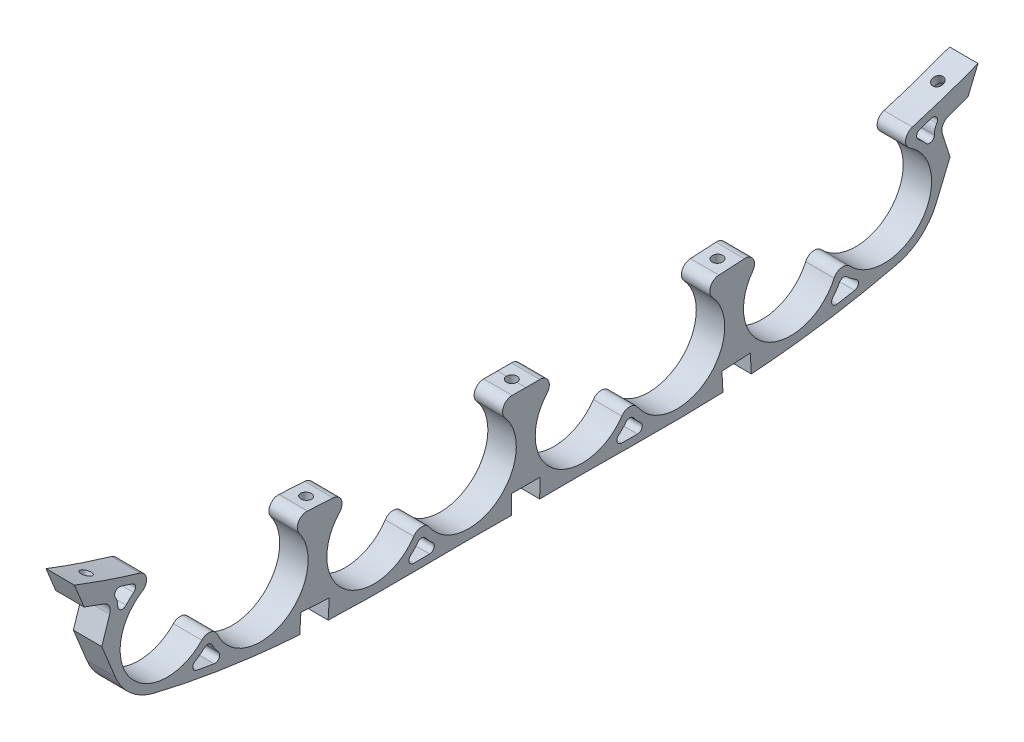
from build123d import *

# Parameters (mm, degrees)
BOSS_EXTRUDE2_DEPTH = 4.7625
CUT_EXTRUDE1_DEPTH  = 156.327035229
SKETCH3_R           = 1.778
CUT_EXTRUDE2_DEPTH  = 155.926710555
SKETCH4_R           = 1.778
CUT_EXTRUDE3_DEPTH  = 154.47151085
SKETCH5_R           = 3.175
CUT_EXTRUDE4_DEPTH  = 3.556
SKETCH6_R           = 1.778
CUT_EXTRUDE5_DEPTH  = 141.566856419


# Read off the part's stored shape, not the designer's step: Mirror1
with BuildPart() as part:
    # Sketch1 → Boss-Extrude2 (new, symmetric)
    with BuildSketch(Plane(origin=(-4.793989049, 0.020738597, -8e-09), x_dir=(-1.5740645192279891e-09, 3.5988585896806374e-12, 1.0), z_dir=(-0.9999906431736159, 0.00432591784689156, -1.5740653593461668e-09))):
        with BuildLine():
            Line((4.097149249, -41.793027475), (4.097149249, -13.281595194))
            add(Edge.make_bspline(
                [(-0.53953751, -13.252646952), (1.006219979, -13.26531204), (2.551775373, -13.275970228), (4.097149249, -13.281595194)],
                knots=[0.971364633, 0.971364633, 0.971364633, 0.971364633, 1, 1, 1, 1], degree=3))
            ThreePointArc((-0.53953751, -13.252646952), (-3.448723494, -15.097901159), (-2.963434091, -18.508593226))
            ThreePointArc((-2.963434091, -18.508593226), (-2.597042641, -18.94642841), (-2.246631473, -19.397154887))
            ThreePointArc((-2.246631473, -19.397154887), (0.109135751, -23.898660497), (0.922149671, -28.913857436))
            ThreePointArc((0.922149671, -28.913857436), (-10.330023088, -44.100861528), (-28.135499878, -37.75882074))
            ThreePointArc((-28.135499878, -37.75882074), (-30.788793596, -36.352857657), (-33.427092785, -37.786760419))
            ThreePointArc((-33.427092785, -37.786760419), (-56.000004833, -41.948908373), (-59.135509194, -19.210648845))
            add(Edge.make_bspline(
                [(-71.253324978, -18.51695643), (-67.22219572, -18.825212212), (-63.182502669, -19.053825628), (-59.135509194, -19.210648845)],
                knots=[0.535293106, 0.535293106, 0.535293106, 0.535293106, 0.609991772, 0.609991772, 0.609991772, 0.609991772], degree=3))
            ThreePointArc((-71.253324978, -18.51695643), (-69.473338821, -22.537426481), (-68.864440234, -26.891938239))
            ThreePointArc((-68.864440234, -26.891938239), (-81.471963152, -42.427034587), (-99.26938115, -33.286970841))
            ThreePointArc((-99.26938115, -33.286970841), (-101.634862692, -31.437323087), (-104.483804941, -32.386126439))
            ThreePointArc((-104.483804941, -32.386126439), (-127.878968465, -32.047286598), (-125.5261293, -8.76826951))
            add(Edge.make_bspline(
                [(-144.126574407, -2.696164985), (-141.693386447, -3.582520341), (-137.657540812, -4.990682155), (-131.449532285, -7.006389931), (-127.680307088, -8.145409373), (-125.5261293, -8.76826951)],
                knots=[0.075396222, 0.075396222, 0.075396222, 0.075396222, 0.123289108, 0.154539108, 0.195826457, 0.195826457, 0.195826457, 0.195826457], degree=3))
            Line((-144.126574407, -2.696164985), (-144.035345412, -2.91800212))
            Line((-144.035345412, -2.91800212), (-137.372810366, -5.342490109))
            ThreePointArc((-137.372810366, -5.342490109), (-135.605099648, -6.933772668), (-135.438662345, -9.306383042))
            Line((-135.438662345, -9.306383042), (-138.072044537, -17.41867238))
            Line((-138.072044537, -17.41867238), (-133.451933082, -28.653173909))
            ThreePointArc((-133.451933082, -28.653173909), (-128.289952657, -35.791230262), (-120.447393147, -39.802732565))
            add(Edge.make_bspline(
                [(-120.447393147, -39.802732565), (-119.532951115, -40.023476944), (-117.088169027, -40.601323697), (-110.953698267, -41.968369708), (-101.9631708, -43.710437587), (-90.800466979, -45.403836777), (-79.689088478, -46.662973433), (-68.62645086, -47.527275454), (-57.58924724, -48.037878216), (-46.678774083, -48.224931934), (-36.12400945, -48.204712413), (-25.891642086, -48.098211972), (-17.621930281, -48.025348577), (-11.245188421, -48.026081616), (-6.353163032, -48.062670944), (-2.777855823, -48.097005295), (-0.863208778, -48.112845404), (-0.665350758, -48.114448781)],
                knots=[0.270797205, 0.270797205, 0.270797205, 0.270797205, 0.286422205, 0.3125, 0.375, 0.4375, 0.5, 0.5625, 0.625, 0.6875, 0.75, 0.8125, 0.875, 0.90625, 0.9375, 0.96875, 0.972344137, 0.972344137, 0.972344137, 0.972344137], degree=3))
            Line((-0.665350758, -48.114448781), (-0.665350758, -43.034495919))
            Line((-0.665350758, -43.034495919), (-0.665350758, -41.793027475))
            Line((-0.665350758, -41.793027475), (4.097149249, -41.793027475))
        make_face()
        with BuildLine():
            add(Edge.make_bspline(
                [(-71.253324978, -18.51695643), (-67.22219572, -18.825212212), (-63.182502669, -19.053825628), (-59.135509194, -19.210648845)],
                knots=[0.535293106, 0.535293106, 0.535293106, 0.535293106, 0.609991772, 0.609991772, 0.609991772, 0.609991772], degree=3))
            ThreePointArc((-59.135509194, -19.210648845), (-58.759053909, -18.754205992), (-58.365851515, -18.312108112))
            ThreePointArc((-58.365851515, -18.312108112), (-57.76280435, -14.949065781), (-60.559443008, -12.986279033))
            add(Edge.make_bspline(
                [(-69.125672753, -12.496550273), (-66.277756699, -12.698507159), (-63.422545246, -12.86072552), (-60.559443008, -12.986279033)],
                knots=[0.545675689, 0.545675689, 0.545675689, 0.545675689, 0.599534345, 0.599534345, 0.599534345, 0.599534345], degree=3))
            ThreePointArc((-69.125672753, -12.496550273), (-72.12797251, -14.125760688), (-71.915123748, -17.534987259))
            ThreePointArc((-71.915123748, -17.534987259), (-71.575065183, -18.019799009), (-71.253324978, -18.51695643))
        make_face()
        with BuildLine():
            ThreePointArc((-124.56901985, -8.106582367), (-123.133846678, -4.986374862), (-125.377235322, -2.385870238))
            add(Edge.make_bspline(
                [(-147.334055934, 5.103312683), (-146.182922193, 4.656581809), (-145.029544194, 4.21810499), (-140.778446111, 2.634569298), (-137.662571866, 1.536548298), (-131.493778533, -0.519119884), (-128.444300845, -1.478850673), (-125.377235322, -2.385870238)],
                knots=[0.039153992, 0.039153992, 0.039153992, 0.039153992, 0.0625, 0.0625, 0.125, 0.125, 0.185264169, 0.185264169, 0.185264169, 0.185264169], degree=3))
            Line((-147.334055934, 5.103312683), (-144.126574407, -2.696164985))
            add(Edge.make_bspline(
                [(-144.126574407, -2.696164985), (-141.693386447, -3.582520341), (-137.657540812, -4.990682155), (-131.449532285, -7.006389931), (-127.680307088, -8.145409373), (-125.5261293, -8.76826951)],
                knots=[0.075396222, 0.075396222, 0.075396222, 0.075396222, 0.123289108, 0.154539108, 0.195826457, 0.195826457, 0.195826457, 0.195826457], degree=3))
            ThreePointArc((-125.5261293, -8.76826951), (-125.053638954, -8.428654007), (-124.56901985, -8.106582367))
        make_face()
    extrude(amount=BOSS_EXTRUDE2_DEPTH, both=True)

    # Sketch2 → Cut-Extrude1 (cut, symmetric)
    with BuildSketch(Plane(origin=(-9.556444487, 0.041340781, -1.5e-08), x_dir=(-1.574050630268585e-09, 6.809277426616461e-12, 1.0), z_dir=(-0.9999906431736159, 0.004325917846891559, -1.5740653585248619e-09))):
        with BuildLine():
            add(Edge.make_bspline(
                [(-127.924566296, -4.256382001), (-128.10234126, -4.200595974), (-128.674156165, -4.02052682), (-129.639031217, -3.713249038), (-130.724348827, -3.362306283), (-131.415582613, -3.135816284), (-131.714216102, -3.037412168)],
                knots=[0.050407538, 0.050407538, 0.050407538, 0.050407538, 0.053922838, 0.061719646, 0.069516453, 0.07545403, 0.07545403, 0.07545403, 0.07545403], degree=3))
            ThreePointArc((-131.714216102, -3.037412168), (-133.452950887, -3.556317089), (-133.569193543, -5.367103828))
            ThreePointArc((-133.569193546, -5.36710383), (-132.945732197, -6.819357874), (-132.743858935, -8.386837715))
            ThreePointArc((-132.743858941, -8.386837714), (-131.718351201, -9.888443674), (-129.955618041, -9.442059993))
            ThreePointArc((-129.955618041, -9.442059993), (-128.744584261, -8.169612106), (-127.417818516, -7.018343632))
            ThreePointArc((-127.417818516, -7.018343632), (-126.83843683, -5.484573931), (-127.924566296, -4.256382001))
        make_face()
        with BuildLine():
            ThreePointArc((-103.531454864, -35.014583834), (-105.046370881, -36.270658322), (-106.686675106, -37.357900572))
            ThreePointArc((-106.686675106, -37.357900572), (-107.445658928, -38.997677259), (-106.17831741, -40.285609518))
            add(Edge.make_bspline(
                [(-106.17831741, -40.285609518), (-105.689424337, -40.378639287), (-104.711253765, -40.562073564), (-103.243222942, -40.829245575), (-101.774672224, -41.088398866), (-100.795508991, -41.255698274), (-100.305943671, -41.337993115)],
                knots=[0.348717241, 0.348717241, 0.348717241, 0.348717241, 0.357017497, 0.365317753, 0.37361801, 0.381918266, 0.381918266, 0.381918266, 0.381918266], degree=3))
            ThreePointArc((-100.305943671, -41.337993115), (-98.66420871, -40.55966513), (-98.828229808, -38.750194154))
            ThreePointArc((-98.828229808, -38.750194154), (-100.027971586, -37.157075068), (-101.048395916, -35.443557359))
            ThreePointArc((-101.048395916, -35.443557359), (-102.184087051, -34.616438766), (-103.531454864, -35.014583834))
        make_face()
        with BuildLine():
            add(Edge.make_bspline(
                [(-71.583160125, -47.271955612), (-70.598651588, -47.341705151), (-67.425498669, -47.552617679), (-64.255489895, -47.719805981), (-62.073674986, -47.815387334)],
                knots=[0.545805938, 0.545805938, 0.545805938, 0.545805938, 0.5625, 0.599632871, 0.599632871, 0.599632871, 0.599632871], degree=3))
            Line((-62.073674986, -47.815387334), (-61.713728471, -41.507312706))
            Line((-61.713728471, -41.507312706), (-71.223259611, -40.964687137))
            Line((-71.223259611, -40.964687137), (-71.583160125, -47.271955612))
        make_face()
        with BuildLine():
            ThreePointArc((-32.028379906, -40.207372166), (-33.189236423, -41.591748315), (-34.480162394, -42.855708484))
            ThreePointArc((-34.480162394, -42.855708484), (-34.908363074, -44.612613191), (-33.413774747, -45.630589469))
            add(Edge.make_bspline(
                [(-33.413774747, -45.630589469), (-32.965810837, -45.626992717), (-32.071534178, -45.619472638), (-30.73513395, -45.607427742), (-29.403652527, -45.594865531), (-28.519261525, -45.586295989), (-28.077877376, -45.582002891)],
                knots=[0.766813177, 0.766813177, 0.766813177, 0.766813177, 0.774973862, 0.783134546, 0.79129523, 0.799455915, 0.799455915, 0.799455915, 0.799455915], degree=3))
            ThreePointArc((-28.077877376, -45.582002891), (-26.60398535, -44.544165428), (-27.050423166, -42.797695394))
            ThreePointArc((-27.050423166, -42.797695394), (-28.342931358, -41.555770069), (-29.508573761, -40.194067557))
            ThreePointArc((-29.508573761, -40.194067557), (-30.771759408, -39.579021592), (-32.028379906, -40.207372166))
        make_face()
    extrude(amount=CUT_EXTRUDE1_DEPTH, both=True, mode=Mode.SUBTRACT)

    # Sketch3 → Cut-Extrude2 (cut, through all)
    with BuildSketch(Plane(origin=(-0.180793203, -41.792636425, 0), x_dir=(0.9999906431736159, -0.0043259178468915615, -1.3888719940127347e-14), z_dir=(-0.0043259178468915615, -0.9999906431736159, -3.2105533385859324e-12))):
        with Locations((-4.794033913, 4.097149242)):
            Circle(SKETCH3_R)
    extrude(amount=-CUT_EXTRUDE2_DEPTH, mode=Mode.SUBTRACT)

    # Sketch4 → Cut-Extrude3 (cut, through all)
    with BuildSketch(Plane(origin=(-0.194158596, -44.882217007, -2.561058592), x_dir=(-0.9999906735409505, 0.004311878412068975, 0.00024603998801603913), z_dir=(-0.0043188923482946175, -0.9983666310131962, -0.05696856368423062))):
        with Locations(Location((4.777085058, 64.011158923, 0), (0, 0, 89.999999805))):
            Circle(SKETCH4_R)
    extrude(amount=-CUT_EXTRUDE3_DEPTH, mode=Mode.SUBTRACT)

    # Sketch5 → Cut-Extrude4 (cut)
    with BuildSketch(Plane(origin=(-0.211372446, -48.861421664, -17.780775278), x_dir=(0.9999917371307839, -0.003827069527391307, -0.0013708424379435622), z_dir=(-0.004065125963528373, -0.9397054241425722, -0.34196080270687346))):
        with Locations(Location((-4.596135763, -130.932063571, 0), (0, 0, 269.998824298))):
            Circle(SKETCH5_R)
    extrude(amount=-CUT_EXTRUDE4_DEPTH, mode=Mode.SUBTRACT)

    # Sketch6 → Cut-Extrude5 (cut, through all)
    with BuildSketch(Plane(origin=(-0.196916858, -45.519829176, -16.564762663), x_dir=(-0.9999917371307839, 0.0038270695273913066, 0.0013708424379435624), z_dir=(-0.004065125963528373, -0.9397054241425723, -0.3419608027068735))):
        with Locations(Location((4.596135763, 130.932063571, 0), (0, 0, 89.998824298))):
            Circle(SKETCH6_R)
    extrude(amount=-CUT_EXTRUDE5_DEPTH, mode=Mode.SUBTRACT)

    # Mirror1: part across plane


with BuildPart() as part_1:
    add(part.part)
    add(part.part.mirror(Plane(origin=(-0.031533617, 0.000136413, 4.097149249), x_dir=(1.0, 0, 1.5740645186890284e-09), z_dir=(1.5740645186890284e-09, -3.598983177295524e-12, -1.0))))


solid = part_1.part
